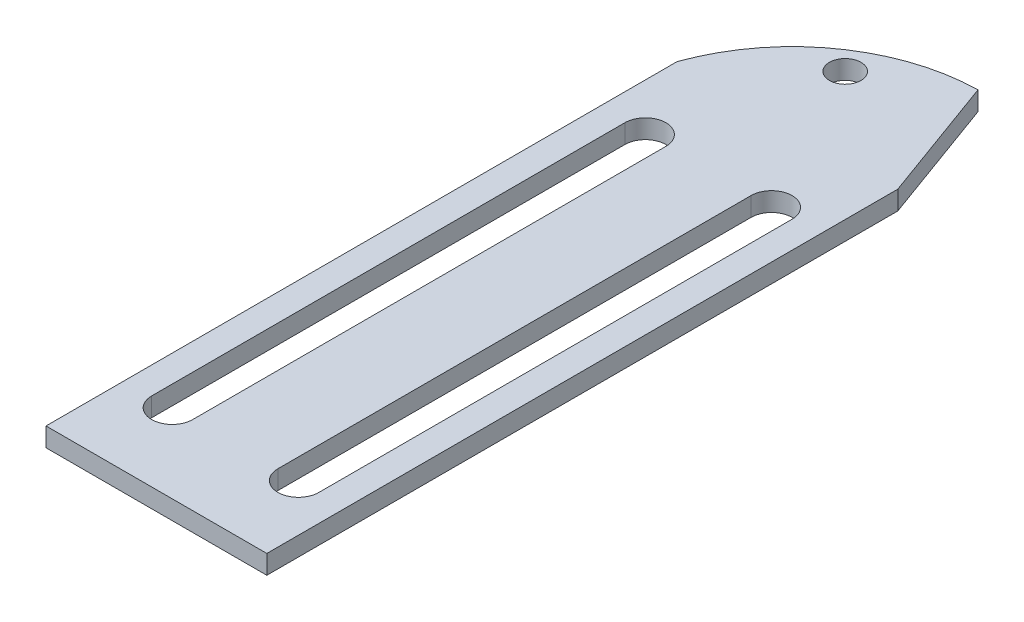
from build123d import *

# Parameters (mm, degrees)
SKETCH1_W           = 35
SKETCH1_H           = 100
SKETCH1_R           = 2.5
BOSS_EXTRUDE1_DEPTH = 3
CUT_EXTRUDE2_DEPTH  = 75.317016198
FILLET1_R           = 30


with BuildPart() as part:
    # Sketch1 → Boss-Extrude1 (new body)
    # profile 1 of 2: a face of its own
    with BuildSketch(Plane(origin=(0, 0, 0), x_dir=(1, 0, 0), z_dir=(0, 1, 0))):
        Rectangle(SKETCH1_W, SKETCH1_H)
    # profile 2 of 2: a face of its own
    with BuildSketch(Plane(origin=(0, 0, 0), x_dir=(1, 0, 0), z_dir=(0, 1, 0))):
        Polygon((17.5, 50), (10.220595315, 70), (-24.779404685, 70), (-17.5, 50), align=None)
        with Locations(Location((-2.830309398, 62, 0), (0, 0, 270))):
            Circle(SKETCH1_R, mode=Mode.SUBTRACT)
    extrude(amount=BOSS_EXTRUDE1_DEPTH)

    # Sketch3 → Cut-Extrude2 (cut, through all)
    with BuildSketch(Plane(origin=(0, 3, 0), x_dir=(1, 0, 0), z_dir=(0, 1, 0))):
        with BuildLine():
            Line((-13.25, -37.5), (-13.25, 37.5))
            ThreePointArc((-13.25, 37.5), (-10, 40.75), (-6.75, 37.5))
            Line((-6.75, 37.5), (-6.75, -37.5))
            ThreePointArc((-6.75, -37.5), (-10, -40.75), (-13.25, -37.5))
        make_face()
        with BuildLine():
            Line((6.75, -37.5), (6.75, 37.5))
            ThreePointArc((6.75, 37.5), (10, 40.75), (13.25, 37.5))
            Line((13.25, 37.5), (13.25, -37.5))
            ThreePointArc((13.25, -37.5), (10, -40.75), (6.75, -37.5))
        make_face()
    extrude(amount=-CUT_EXTRUDE2_DEPTH, mode=Mode.SUBTRACT)

    # Fillet1
    # the kernel refuses this fillet: 30 mm, written as the material it takes off along each edge
    with BuildSketch(Plane(origin=(-24.779404685, -88.909189832, -70), x_dir=(1, 0, 0), z_dir=(0, 1, 0))) as fillet1_piece_1:
        with BuildLine():
            CenterArc((35.563675933, -30), FILLET1_R, 90, 70.528779366)
            Line((7.279404685, -20), (0, 0))
            Line((0, 0), (35.563675933, 0))
        make_face()
    extrude(amount=180.818379664, mode=Mode.SUBTRACT)


solid = part.part
